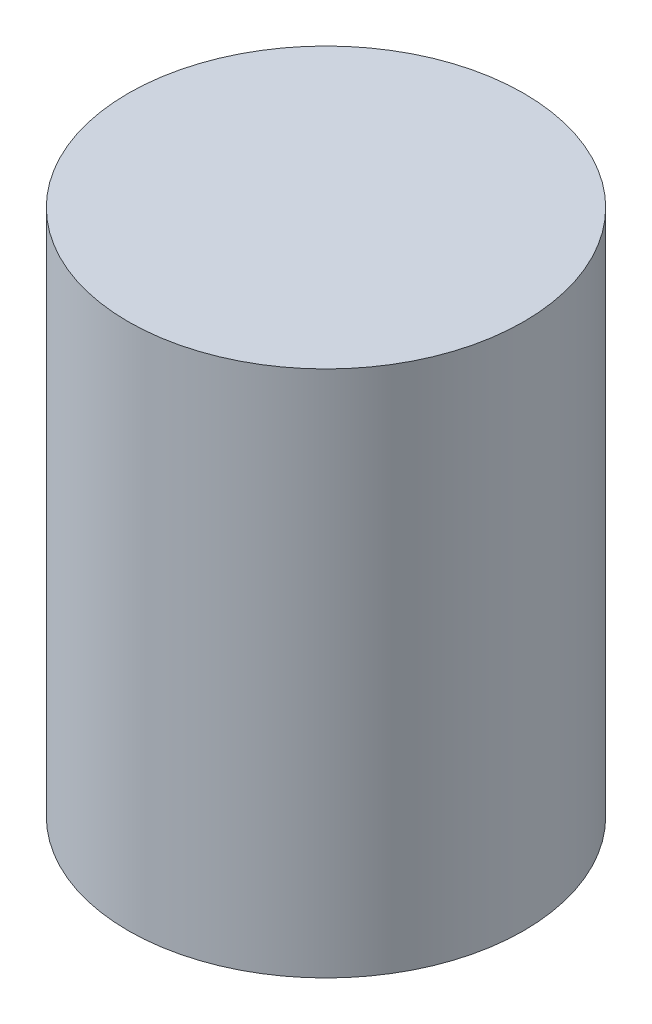
from build123d import *

# Parameters (mm, degrees)
CROQUIS2_R              = 15
SALIENTE_EXTRUIR1_DEPTH = 40


with BuildPart() as part:
    # Croquis2 → Saliente-Extruir1 (new body)
    with BuildSketch(Plane(origin=(0, 0, 0), x_dir=(1, 0, 0), z_dir=(0, 1, 0))):
        Circle(CROQUIS2_R)
    extrude(amount=SALIENTE_EXTRUIR1_DEPTH)


solid = part.part
